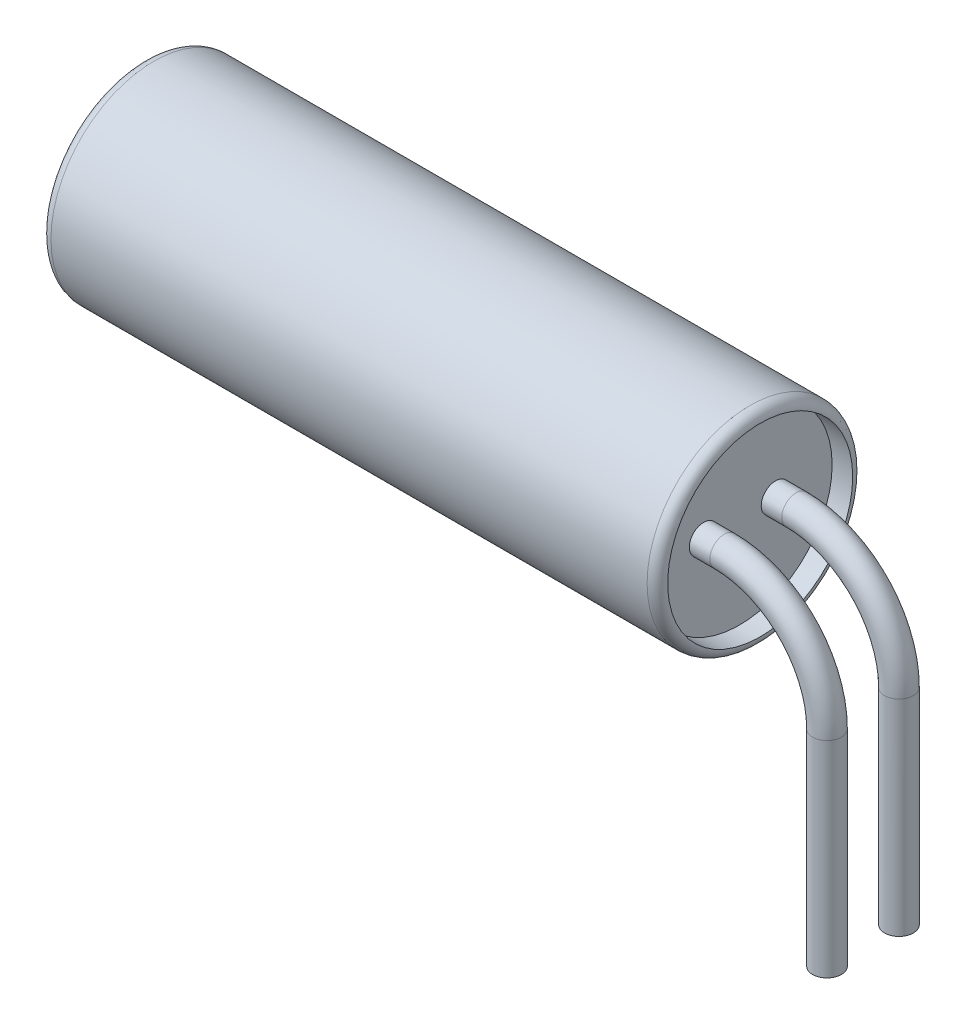
from build123d import *

# Parameters (mm, degrees)
SKETCH_1_R          = 1
EXTRUDE_1_DEPTH     = 6
SKETCH_2_R          = 0.9
CUT_EXTRUDE_1_DEPTH = 5.8
SKETCH_5_R          = 0.9
EXTRUDE_4_DEPTH     = 5.6
SKETCH_7_R          = 0.14
FILLET_1_R          = 0.1
FILLET_2_R          = 0.1


with BuildPart() as part:
    # 草图1 → 凸台-拉伸1 (new body)
    with BuildSketch(Plane(origin=(0, 0, 0), x_dir=(0, 0, -1), z_dir=(1, 0, 0))):
        Circle(SKETCH_1_R)
    extrude(amount=-EXTRUDE_1_DEPTH)

    # 草图2 → 切除-拉伸1 (cut)
    with BuildSketch(Plane(origin=(0, 0, 0), x_dir=(0, 0, -1), z_dir=(1, 0, 0))):
        Circle(SKETCH_2_R)
    extrude(amount=-CUT_EXTRUDE_1_DEPTH, mode=Mode.SUBTRACT)



with BuildPart() as body_2:
    # 草图5 → 凸台-拉伸4 (new body)
    with BuildSketch(Plane(origin=(-5.8, 0, 0), x_dir=(0, 0, -1), z_dir=(1, 0, 0))):
        Circle(SKETCH_5_R)
    extrude(amount=EXTRUDE_4_DEPTH)


with BuildPart() as part_1:
    add(part.part)

    add(body_2.part)  # 扫描1 merges body 2
    # 扫描1: sweep along a curve in space
    with BuildLine() as sweep_1_path:
        Line((-0.2, 0, -0.35), (0, 0, -0.35))
        ThreePointArc((0, 0, -0.35), (0.707106781, -0.292893219, -0.35), (1, -1, -0.35))
        Line((1, -1, -0.35), (1, -3, -0.35))
    # 草图7 → 扫描1 (sweep)
    with BuildSketch(Plane(origin=(-0.2, 0, 0), x_dir=(0, 0, -1), z_dir=(1, 0, 0))):
        with Locations((0.35, 0)):
            Circle(SKETCH_7_R)
    sweep_1 = sweep(path=sweep_1_path.line)

    # 镜向1: 扫描1 across plane
    add(sweep_1.mirror(Plane.XY))

    # 圆角1
    fillet_1_edges = [part_1.edges().sort_by_distance(p)[0] for p in [
        (-6, 0, 1),
    ]]
    fillet(fillet_1_edges, radius=FILLET_1_R)

    # 圆角2
    fillet_2_edges = [part_1.edges().sort_by_distance(p)[0] for p in [
        (0, 0, 1),
    ]]
    fillet(fillet_2_edges, radius=FILLET_2_R - 0.0001)  # a hair under: the kernel refuses the full size


solid = part_1.part
